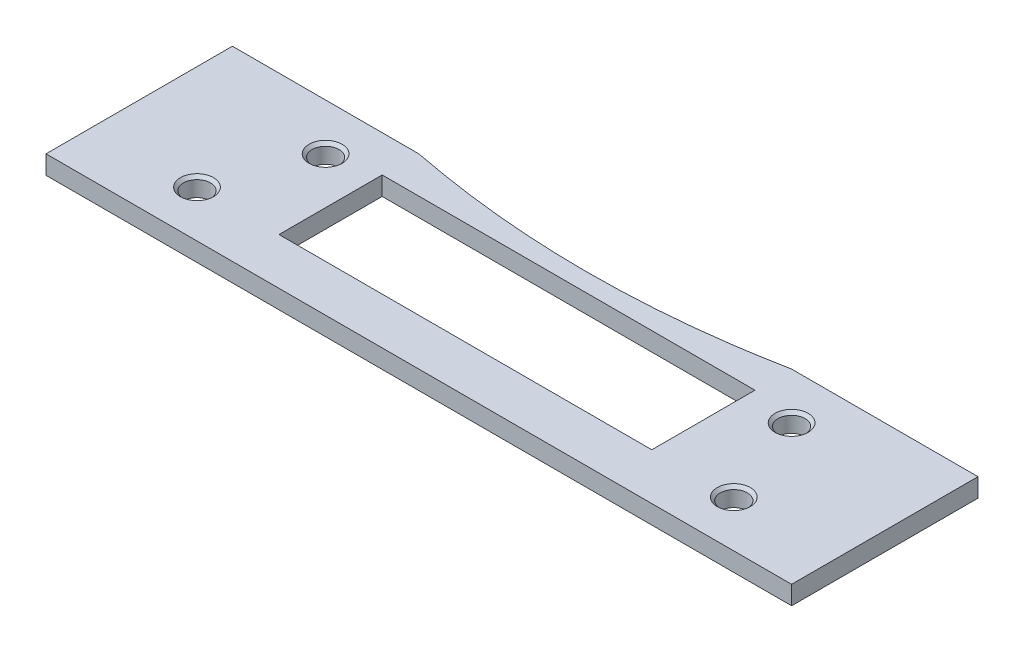
from build123d import *

# Parameters (mm, degrees)
SKETCH_1_W                     = 80
SKETCH_1_H                     = 20
EXTRUDE_1_DEPTH                = 2
HOLE_WIZARD_M3_5_1_D           = 2.9
HOLE_WIZARD_M3_5_1_CSINK_D     = 3.55
HOLE_WIZARD_M3_5_1_CSINK_ANGLE = 90
SKETCH_2_R                     = 1
SKETCH_2_W                     = 40
SKETCH_2_H                     = 11.070555875
CUT_EXTRUDE_2_DEPTH            = 10
CUT_EXTRUDE_5_DEPTH            = 10


with BuildPart() as part:
    # 草图1 → 凸台-拉伸1 (new body)
    with BuildSketch(Plane(origin=(0, 0, 0), x_dir=(1, 0, 0), z_dir=(0, 1, 0))):
        with Locations((40, 10)):
            Rectangle(SKETCH_1_W, SKETCH_1_H)
    extrude(amount=EXTRUDE_1_DEPTH)

    # M3.5 螺纹孔1 (through all)
    with Locations(Plane(origin=(0, 2, 0), x_dir=(1, 0, 0), z_dir=(0, 1, 0))):
        with Locations((15, 15), (11.2, 5), (65, 15), (68.8, 5)):
            CounterSinkHole(HOLE_WIZARD_M3_5_1_D / 2, HOLE_WIZARD_M3_5_1_CSINK_D / 2, counter_sink_angle=HOLE_WIZARD_M3_5_1_CSINK_ANGLE)

    # 草图2 → 切除-拉伸2 (cut)
    with BuildSketch(Plane(origin=(0, 2, 0), x_dir=(1, 0, 0), z_dir=(0, 1, 0))):
        with Locations((15, 15)):
            Circle(SKETCH_2_R)
        with Locations((65, 15)):
            Circle(SKETCH_2_R)
        with Locations((11.2, 5)):
            Circle(SKETCH_2_R)
        with Locations((68.8, 5)):
            Circle(SKETCH_2_R)
        with Locations((40, 10.535277938)):
            Rectangle(SKETCH_2_W, SKETCH_2_H)
    extrude(amount=-CUT_EXTRUDE_2_DEPTH, mode=Mode.SUBTRACT)

    # 草图7 → 切除-拉伸5 (cut)
    with BuildSketch(Plane(origin=(0, 2, 0), x_dir=(1, 0, 0), z_dir=(0, 1, 0))):
        with BuildLine():
            Line((60, 20), (20, 20))
            add(Edge.make_bspline(
                [(20, 20), (40, 16.070555875), (60, 20)],
                knots=[0, 0, 0, 1, 1, 1], degree=2))
        make_face()
    extrude(amount=-CUT_EXTRUDE_5_DEPTH, mode=Mode.SUBTRACT)


solid = part.part
